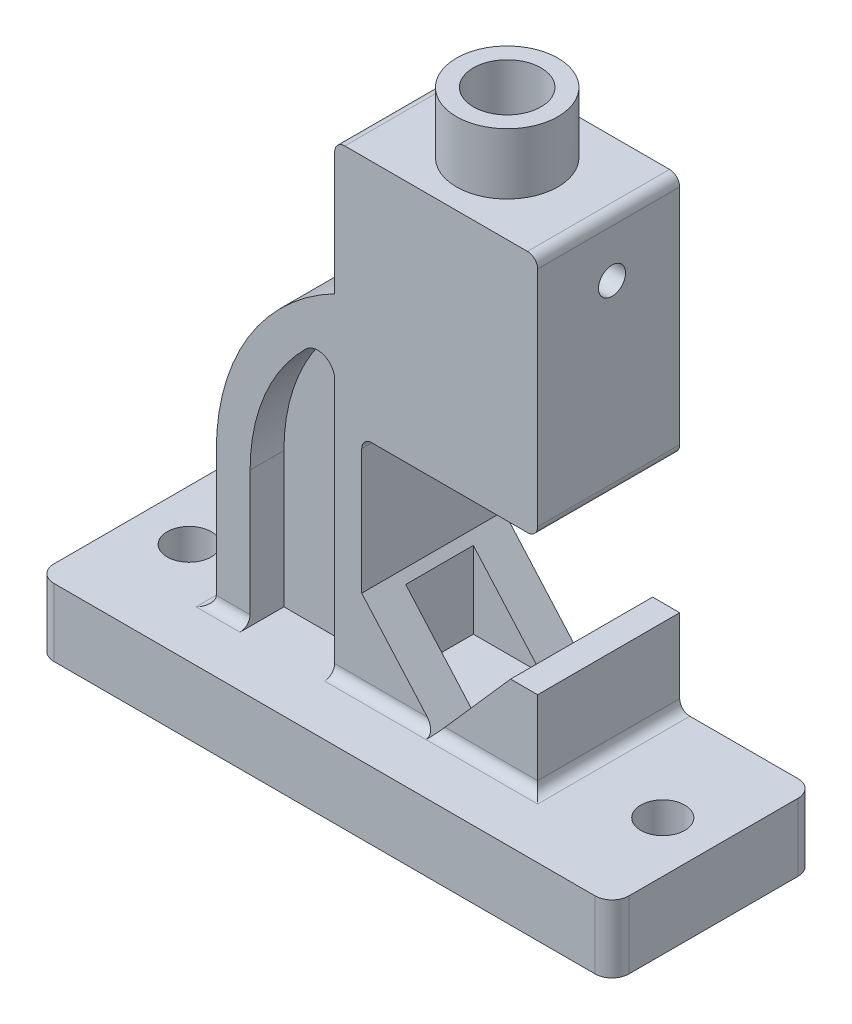
from build123d import *

# Parameters (mm, degrees)
BOSS_EXTRUDE1_DEPTH = 60
BOSS_EXTRUDE2_DEPTH = 42
CUT_EXTRUDE1_DEPTH  = 42
SKETCH4_R           = 15
SKETCH4_R_2         = 10
BOSS_EXTRUDE4_DEPTH = 18
CUT_EXTRUDE2_START  = -10
SKETCH4_2_R         = 10
CUT_EXTRUDE2_DEPTH  = 10
CUT_EXTRUDE3_START  = -127
SKETCH5_W           = 40
SKETCH5_H           = 20
CUT_EXTRUDE3_DEPTH  = 127
SKETCH6_R           = 6.5
CUT_EXTRUDE4_DEPTH  = 183
SKETCH7_R           = 4
CUT_EXTRUDE5_DEPTH  = 245
FILLET1_R           = 3
FILLET2_R           = 5
BOSS_EXTRUDE6_DEPTH = 22


with BuildPart() as part:
    # Sketch1 → Boss-Extrude1 (new body)
    with BuildSketch(Plane.XY):
        Polygon((170, 20), (130, 20), (0, 20), (0, 0), (170, 0), align=None)
    extrude(amount=BOSS_EXTRUDE1_DEPTH)

    # Sketch1<3> → Boss-Extrude2 (add)
    with BuildSketch(Plane.XY):
        with BuildLine():
            Line((35, 60), (35, 20))
            Line((35, 20), (45, 20))
            Line((45, 20), (45, 60))
            ThreePointArc((45, 60), (49.292505485, 81.301408404), (61.5, 99.277856357))
            ThreePointArc((61.5, 99.277856357), (66.936491673, 100.316914371), (70, 95.707142143))
            Line((70, 95.707142143), (70, 20))
            Line((70, 20), (100, 20))
            Line((100, 20), (78, 45))
            Line((78, 45), (78, 85))
            Line((78, 85), (130, 85))
            Line((130, 85), (130, 157))
            Line((130, 157), (115, 157))
            Line((115, 157), (115, 175))
            Line((115, 175), (85, 175))
            Line((85, 175), (85, 157))
            Line((85, 157), (70, 157))
            Line((70, 157), (70, 117.662812973))
            ThreePointArc((70, 117.662812973), (44.434723073, 93.726843908), (35, 60))
        make_face()
        Polygon((100, 20), (130, 20), (130, 45), (122, 45), align=None)
    extrude(amount=BOSS_EXTRUDE2_DEPTH)

    # Sketch3 → Cut-Extrude1 (cut)
    with BuildSketch(Plane(origin=(115, 0, 0), x_dir=(0, 0, -1), z_dir=(1, 0, 0))):
        Polygon((-42, 157), (7.234036257, 157), (7.234036257, 179.627454065), (-54.634398112, 179.627454065), (-54.634398112, 157), align=None)
    extrude(amount=-CUT_EXTRUDE1_DEPTH, mode=Mode.SUBTRACT)

    # Sketch4 → Boss-Extrude4 (add)
    with BuildSketch(Plane(origin=(0, 157, 0), x_dir=(1, 0, 0), z_dir=(0, 1, 0))):
        with Locations((100, -21)):
            Circle(SKETCH4_R)
        with Locations(Location((100, -21, 0), (0, 0, 180))):
            Circle(SKETCH4_R_2, mode=Mode.SUBTRACT)
    extrude(amount=BOSS_EXTRUDE4_DEPTH)

    # Sketch4<2> → Cut-Extrude2 (cut)
    with BuildSketch(Plane(origin=(0, 157, 0), x_dir=(1, 0, 0), z_dir=(0, 1, 0)).offset(CUT_EXTRUDE2_START)):
        with Locations(Location((100, -21, 0), (0, 0, 180))):
            Circle(SKETCH4_2_R)
    extrude(amount=CUT_EXTRUDE2_DEPTH, mode=Mode.SUBTRACT)

    # Sketch5 → Cut-Extrude3 (cut)
    with BuildSketch(Plane(origin=(0, 147, 0), x_dir=(1, 0, 0), z_dir=(0, 1, 0)).offset(CUT_EXTRUDE3_START)):
        with Locations((100, -21)):
            Rectangle(SKETCH5_W, SKETCH5_H)
    extrude(amount=CUT_EXTRUDE3_DEPTH, mode=Mode.SUBTRACT)

    # Sketch6 → Cut-Extrude4 (cut)
    with BuildSketch(Plane(origin=(0, 20, 0), x_dir=(1, 0, 0), z_dir=(0, 1, 0))):
        with Locations(Location((15, -30, 0), (0, 0, 180))):
            Circle(SKETCH6_R)
        with Locations(Location((155, -30, 0), (0, 0, 180))):
            Circle(SKETCH6_R)
    extrude(amount=-CUT_EXTRUDE4_DEPTH, mode=Mode.SUBTRACT)

    # Sketch7 → Cut-Extrude5 (cut)
    with BuildSketch(Plane(origin=(130, 0, 0), x_dir=(0, 0, -1), z_dir=(1, 0, 0))):
        with Locations((-20, 140)):
            Circle(SKETCH7_R)
    extrude(amount=-CUT_EXTRUDE5_DEPTH, mode=Mode.SUBTRACT)

    # Fillet1
    # the kernel refuses this fillet: 3 mm, written as the material it adds along each edge
    with BuildSketch(Plane(origin=(100, 20, 42), x_dir=(0, 0, 1), z_dir=(1, 0, 0))) as fillet1_piece_1_section:
        with BuildLine():
            CenterArc((FILLET1_R, -FILLET1_R), FILLET1_R, 90, 90)
            Line((0, -FILLET1_R), (0, 0))
            Line((0, 0), (FILLET1_R, 0))
        make_face()
    fillet1_piece_1 = extrude(amount=30, mode=Mode.PRIVATE)
    fillet1_piece_1 = split(fillet1_piece_1, bisect_by=Plane(origin=(107.006094621, 27.96147116, 42.686468699), z_dir=(0.7507135169227557, -0.6606278948920244, 0)), keep=Keep.TOP, mode=Mode.PRIVATE)
    add(fillet1_piece_1)
    with BuildSketch(Plane(origin=(78, 85, 0), x_dir=(0, -1, 0), z_dir=(0, 0, 1))) as fillet1_piece_2_section:
        with BuildLine():
            CenterArc((FILLET1_R, FILLET1_R), FILLET1_R, 180, 90)
            Line((0, FILLET1_R), (0, 0))
            Line((0, 0), (FILLET1_R, 0))
        make_face()
    fillet1_piece_2 = extrude(amount=42, mode=Mode.PRIVATE)
    fillet1_piece_2 = split(fillet1_piece_2, bisect_by=Plane(origin=(78.588320005, 84.284989696, 11), z_dir=(0, 0, -1)), keep=Keep.TOP, mode=Mode.PRIVATE)
    fillet1_piece_2 = split(fillet1_piece_2, bisect_by=Plane(origin=(80, 84.284989696, 5.5), z_dir=(-1, 0, 0)), keep=Keep.TOP, mode=Mode.PRIVATE)
    add(fillet1_piece_2)
    with BuildSketch(Plane(origin=(78, 85, 0), x_dir=(0, -1, 0), z_dir=(0, 0, 1))) as fillet1_piece_3_section:
        with BuildLine():
            CenterArc((FILLET1_R, FILLET1_R), FILLET1_R, 180, 90)
            Line((0, FILLET1_R), (0, 0))
            Line((0, 0), (FILLET1_R, 0))
        make_face()
    fillet1_piece_3 = extrude(amount=42, mode=Mode.PRIVATE)
    fillet1_piece_3 = split(fillet1_piece_3, bisect_by=Plane(origin=(80.37802851, 84.990607918, 11), z_dir=(0, 0, -1)), keep=Keep.TOP, mode=Mode.PRIVATE)
    fillet1_piece_3 = split(fillet1_piece_3, bisect_by=Plane(origin=(80, 84.990607918, 5.5), z_dir=(1, 0, 0)), keep=Keep.TOP, mode=Mode.PRIVATE)
    add(fillet1_piece_3)
    with BuildSketch(Plane(origin=(78, 85, 0), x_dir=(0, -1, 0), z_dir=(0, 0, 1))) as fillet1_piece_4_section:
        with BuildLine():
            CenterArc((FILLET1_R, FILLET1_R), FILLET1_R, 180, 90)
            Line((0, FILLET1_R), (0, 0))
            Line((0, 0), (FILLET1_R, 0))
        make_face()
    fillet1_piece_4 = extrude(amount=42, mode=Mode.PRIVATE)
    fillet1_piece_4 = split(fillet1_piece_4, bisect_by=Plane(origin=(78.588320005, 84.284989696, 11), z_dir=(0, 0, 1)), keep=Keep.TOP, mode=Mode.PRIVATE)
    fillet1_piece_4 = split(fillet1_piece_4, bisect_by=Plane(origin=(80, 84.284989696, 21), z_dir=(-1, 0, 0)), keep=Keep.TOP, mode=Mode.PRIVATE)
    fillet1_piece_4 = split(fillet1_piece_4, bisect_by=Plane(origin=(78.588320005, 84.284989696, 31), z_dir=(0, 0, -1)), keep=Keep.TOP, mode=Mode.PRIVATE)
    add(fillet1_piece_4)
    with BuildSketch(Plane(origin=(78, 85, 0), x_dir=(0, -1, 0), z_dir=(0, 0, 1))) as fillet1_piece_5_section:
        with BuildLine():
            CenterArc((FILLET1_R, FILLET1_R), FILLET1_R, 180, 90)
            Line((0, FILLET1_R), (0, 0))
            Line((0, 0), (FILLET1_R, 0))
        make_face()
    fillet1_piece_5 = extrude(amount=42, mode=Mode.PRIVATE)
    fillet1_piece_5 = split(fillet1_piece_5, bisect_by=Plane(origin=(80, 84.284989696, 36.5), z_dir=(-1, 0, 0)), keep=Keep.TOP, mode=Mode.PRIVATE)
    fillet1_piece_5 = split(fillet1_piece_5, bisect_by=Plane(origin=(78.588320005, 84.284989696, 31), z_dir=(0, 0, 1)), keep=Keep.TOP, mode=Mode.PRIVATE)
    add(fillet1_piece_5)
    with BuildSketch(Plane(origin=(78, 85, 0), x_dir=(0, -1, 0), z_dir=(0, 0, 1))) as fillet1_piece_6_section:
        with BuildLine():
            CenterArc((FILLET1_R, FILLET1_R), FILLET1_R, 180, 90)
            Line((0, FILLET1_R), (0, 0))
            Line((0, 0), (FILLET1_R, 0))
        make_face()
    fillet1_piece_6 = extrude(amount=42, mode=Mode.PRIVATE)
    fillet1_piece_6 = split(fillet1_piece_6, bisect_by=Plane(origin=(80, 84.990607918, 36.5), z_dir=(1, 0, 0)), keep=Keep.TOP, mode=Mode.PRIVATE)
    fillet1_piece_6 = split(fillet1_piece_6, bisect_by=Plane(origin=(80.37802851, 84.990607918, 31), z_dir=(0, 0, 1)), keep=Keep.TOP, mode=Mode.PRIVATE)
    add(fillet1_piece_6)
    with BuildSketch(Plane(origin=(130, 20, 0), x_dir=(1, 0, 0), z_dir=(0, 0, 1))) as fillet1_piece_7:
        with BuildLine():
            CenterArc((FILLET1_R, FILLET1_R), FILLET1_R, 180, 90)
            Line((0, FILLET1_R), (0, 0))
            Line((0, 0), (FILLET1_R, 0))
        make_face()
    extrude(amount=42)
    with BuildSketch(Plane(origin=(70, 20, 42), x_dir=(0, 0, 1), z_dir=(1, 0, 0))) as fillet1_piece_8_section:
        with BuildLine():
            CenterArc((FILLET1_R, -FILLET1_R), FILLET1_R, 90, 90)
            Line((0, -FILLET1_R), (0, 0))
            Line((0, 0), (FILLET1_R, 0))
        make_face()
    fillet1_piece_8 = extrude(amount=30, mode=Mode.PRIVATE)
    fillet1_piece_8 = split(fillet1_piece_8, bisect_by=Plane(origin=(92.993905379, 27.96147116, 42.686468699), z_dir=(-0.7507135169227557, -0.6606278948920244, 0)), keep=Keep.TOP, mode=Mode.PRIVATE)
    add(fillet1_piece_8)
    with BuildSketch(Plane(origin=(35, 20, 0), x_dir=(-1, 0, 0), z_dir=(0, 0, 1))) as fillet1_piece_9:
        with BuildLine():
            CenterArc((FILLET1_R, -FILLET1_R), FILLET1_R, 90, 90)
            Line((0, -FILLET1_R), (0, 0))
            Line((0, 0), (FILLET1_R, 0))
        make_face()
    extrude(amount=42)
    with BuildSketch(Plane(origin=(35, 20, 42), x_dir=(0, 0, 1), z_dir=(1, 0, 0))) as fillet1_piece_10:
        with BuildLine():
            CenterArc((FILLET1_R, -FILLET1_R), FILLET1_R, 90, 90)
            Line((0, -FILLET1_R), (0, 0))
            Line((0, 0), (FILLET1_R, 0))
        make_face()
    extrude(amount=10)
    with BuildSketch(Plane(origin=(130, 20, 0), x_dir=(1, 0, 0), z_dir=(0, 0, 1))) as fillet1_piece_11a_section:
        with BuildLine():
            CenterArc((FILLET1_R, FILLET1_R), FILLET1_R, 180, 90)
            Line((0, FILLET1_R), (0, 0))
            Line((0, 0), (FILLET1_R, 0))
        make_face()
    fillet1_piece_11a = extrude(amount=49.5, mode=Mode.PRIVATE)
    fillet1_piece_11a = split(fillet1_piece_11a, bisect_by=Plane(origin=(130.679185343, 20.679185343, 42), z_dir=(0, 0, 1)), keep=Keep.TOP, mode=Mode.PRIVATE)
    with BuildSketch(Plane(origin=(100, 20, 42), x_dir=(0, 0, 1), z_dir=(1, 0, 0))) as fillet1_piece_11b_section:
        with BuildLine():
            CenterArc((FILLET1_R, -FILLET1_R), FILLET1_R, 90, 90)
            Line((0, -FILLET1_R), (0, 0))
            Line((0, 0), (FILLET1_R, 0))
        make_face()
    fillet1_piece_11b = extrude(amount=37.5, mode=Mode.PRIVATE)
    fillet1_piece_11b = split(fillet1_piece_11b, bisect_by=Plane(origin=(130, 20.679185343, 42.679185343), z_dir=(1, 0, 0)), keep=Keep.TOP, mode=Mode.PRIVATE)
    fillet1_piece_11 = fillet1_piece_11a & fillet1_piece_11b
    add(fillet1_piece_11)
    with BuildSketch(Plane(origin=(35, 20, 0), x_dir=(-1, 0, 0), z_dir=(0, 0, 1))) as fillet1_piece_12a_section:
        with BuildLine():
            CenterArc((FILLET1_R, -FILLET1_R), FILLET1_R, 90, 90)
            Line((0, -FILLET1_R), (0, 0))
            Line((0, 0), (FILLET1_R, 0))
        make_face()
    fillet1_piece_12a = extrude(amount=49.5, mode=Mode.PRIVATE)
    fillet1_piece_12a = split(fillet1_piece_12a, bisect_by=Plane(origin=(34.320814657, 20.679185343, 42), z_dir=(0, 0, 1)), keep=Keep.TOP, mode=Mode.PRIVATE)
    with BuildSketch(Plane(origin=(27.5, 20, 42), x_dir=(0, 0, 1), z_dir=(1, 0, 0))) as fillet1_piece_12b_section:
        with BuildLine():
            CenterArc((FILLET1_R, -FILLET1_R), FILLET1_R, 90, 90)
            Line((0, -FILLET1_R), (0, 0))
            Line((0, 0), (FILLET1_R, 0))
        make_face()
    fillet1_piece_12b = extrude(amount=17.5, mode=Mode.PRIVATE)
    fillet1_piece_12b = split(fillet1_piece_12b, bisect_by=Plane(origin=(35, 20.679185343, 42.679185343), z_dir=(-1, 0, 0)), keep=Keep.TOP, mode=Mode.PRIVATE)
    fillet1_piece_12 = fillet1_piece_12a & fillet1_piece_12b
    add(fillet1_piece_12)
    # the kernel refuses this fillet: 3 mm, written as the material it takes off along each edge
    with BuildSketch(Plane(origin=(70, 157, -7.5), x_dir=(1, 0, 0), z_dir=(0, 0, 1))) as fillet1_2_piece_1:
        with BuildLine():
            CenterArc((FILLET1_R, -FILLET1_R), FILLET1_R, 90, 90)
            Line((0, -FILLET1_R), (0, 0))
            Line((0, 0), (FILLET1_R, 0))
        make_face()
    extrude(amount=57, mode=Mode.SUBTRACT)
    with BuildSketch(Plane(origin=(130, 157, -7.5), x_dir=(-1, 0, 0), z_dir=(0, 0, 1)), Plane(origin=(130, 85, -7.5), x_dir=(0, 1, 0), z_dir=(0, 0, 1))) as fillet1_2_piece_2:
        with BuildLine():
            CenterArc((FILLET1_R, FILLET1_R), FILLET1_R, 180, 90)
            Line((0, FILLET1_R), (0, 0))
            Line((0, 0), (FILLET1_R, 0))
        make_face()
    extrude(amount=57, mode=Mode.SUBTRACT)

    # Fillet2
    fillet2_edges = [part.edges().sort_by_distance(p)[0] for p in [
        (0, 10, 60),
        (170, 10, 60),
        (170, 10, 0),
        (0, 10, 0),
    ]]
    fillet(fillet2_edges, radius=FILLET2_R)

    # Sketch8 → Boss-Extrude6 (add)
    with BuildSketch(Plane(origin=(0, 0, 10), x_dir=(-1, 0, 0), z_dir=(0, 0, -1))):
        with BuildLine():
            ThreePointArc((-45, 60), (-49.292505485, 81.301408404), (-61.5, 99.277856357))
            ThreePointArc((-61.5, 99.277856357), (-66.936491673, 100.316914371), (-70, 95.707142143))
            Line((-70, 95.707142143), (-70, 20))
            Line((-70, 20), (-45, 20))
            Line((-45, 20), (-45, 60))
        make_face()
    extrude(amount=-BOSS_EXTRUDE6_DEPTH)


solid = part.part
